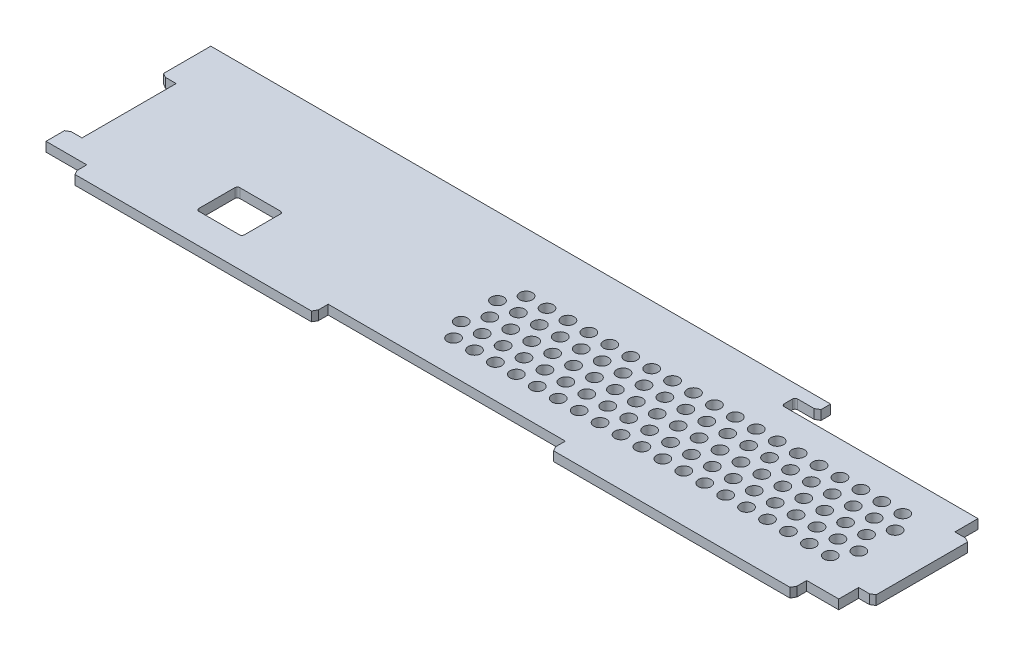
from build123d import *
from OCP.BRepFilletAPI import BRepFilletAPI_MakeChamfer

# Parameters (mm, degrees)
SKETCH1_W               = 245.11
SKETCH1_H               = 50
BOSS_EXTRUDE1_DEPTH     = 2.8575
SKETCH3_W               = 73.236666582
SKETCH3_H               = 4.318
BOSS_EXTRUDE2_DEPTH     = 2.8575
CUT_EXTRUDE1_REACH      = 128.045
SKETCH4_W               = 4.572
SKETCH4_H               = 28.575
SKETCH4_H_2             = 7.0105
SKETCH4_H_3             = 6.0325
CUT_EXTRUDE2_REACH      = 128.045
CUT_EXTRUDE3_REACH      = 128.045
SKETCH6_W               = 13.843
SKETCH6_H               = 12.446
SKETCH8_R               = 0.635
CUT_EXTRUDE4_DEPTH      = 0.127
FILL_PATTERN1_OUTLINE_R = 1.905
FILL_PATTERN1_DEPTH     = 2.8575
CHAMFER1_SIZE           = 0.762
CHAMFER1_SIZE2          = 1.319822715
CHAMFER2_SIZE           = 0.762
CHAMFER2_SIZE2          = 1.319822715
FILLET1_R               = 0.762


# Read off the part's stored shape, not the designer's step: Fill Pattern1
with BuildPart() as part:
    # Sketch1 → Boss-Extrude1 (new body)
    with BuildSketch(Plane(origin=(0, 0, 0), x_dir=(1, 0, 0), z_dir=(0, 1, 0))):
        Rectangle(SKETCH1_W, SKETCH1_H)
    extrude(amount=BOSS_EXTRUDE1_DEPTH)

    # Sketch3 → Boss-Extrude2 (add)
    with BuildSketch(Plane.XZ):
        with Locations((-73.554166709, 27.159)):
            Rectangle(SKETCH3_W, SKETCH3_H)
        with Locations((71.649166455, 27.159)):
            Rectangle(SKETCH3_W, SKETCH3_H)
    extrude(amount=-BOSS_EXTRUDE2_DEPTH)

    # Sketch4 → Cut-Extrude1 (cut, up to next)
    with BuildSketch(Plane(origin=(0, 2.8575, 0), x_dir=(1, 0, 0), z_dir=(0, 1, 0)), mode=Mode.PRIVATE) as cut_extrude1_sk1:
        with Locations((-120.269, -4.3625)):
            Rectangle(SKETCH4_W, SKETCH4_H)
    cut_extrude1_tool1 = extrude(cut_extrude1_sk1.sketch, amount=-CUT_EXTRUDE1_REACH, mode=Mode.PRIVATE) & part.part
    # Sketch4 → Cut-Extrude1 (cut, up to next)
    with BuildSketch(Plane(origin=(0, 2.8575, 0), x_dir=(1, 0, 0), z_dir=(0, 1, 0)), mode=Mode.PRIVATE) as cut_extrude1_sk2:
        with Locations((120.269, 13.74775)):
            Rectangle(SKETCH4_W, SKETCH4_H_2)
    cut_extrude1_tool2 = extrude(cut_extrude1_sk2.sketch, amount=-CUT_EXTRUDE1_REACH, mode=Mode.PRIVATE) & part.part
    # Sketch4 → Cut-Extrude1 (cut, up to next)
    with BuildSketch(Plane(origin=(0, 2.8575, 0), x_dir=(1, 0, 0), z_dir=(0, 1, 0)), mode=Mode.PRIVATE) as cut_extrude1_sk3:
        with Locations((120.269, -21.98375)):
            Rectangle(SKETCH4_W, SKETCH4_H_3)
    cut_extrude1_tool3 = extrude(cut_extrude1_sk3.sketch, amount=-CUT_EXTRUDE1_REACH, mode=Mode.PRIVATE) & part.part
    add(cut_extrude1_tool1.solids().sort_by_distance((-120.269, 2.8575, 4.3625))[0], mode=Mode.SUBTRACT)
    add(cut_extrude1_tool2.solids().sort_by_distance((120.269, 2.8575, -13.74775))[0], mode=Mode.SUBTRACT)
    add(cut_extrude1_tool3.solids().sort_by_distance((120.269, 2.8575, 21.98375))[0], mode=Mode.SUBTRACT)

    # Sketch5 → Cut-Extrude2 (cut, up to next)
    with BuildSketch(Plane(origin=(0, 2.8575, 0), x_dir=(1, 0, 0), z_dir=(0, 1, 0)), mode=Mode.PRIVATE) as cut_extrude2_sk1:
        Polygon((65.532, 25), (122.555, 25), (122.555, 17.253), (58.42, 17.253), (58.42, 21.317), (65.532, 21.317), align=None)
    cut_extrude2_tool1 = extrude(cut_extrude2_sk1.sketch, amount=-CUT_EXTRUDE2_REACH, mode=Mode.PRIVATE) & part.part
    add(cut_extrude2_tool1.solids().sort_by_distance((92.074241, 2.8575, -21.013414))[0], mode=Mode.SUBTRACT)

    # Sketch6 → Cut-Extrude3 (cut, up to next)
    with BuildSketch(Plane(origin=(0, 2.8575, 0), x_dir=(1, 0, 0), z_dir=(0, 1, 0)), mode=Mode.PRIVATE) as cut_extrude3_sk1:
        with Locations((-74.803, -14.0018)):
            Rectangle(SKETCH6_W, SKETCH6_H)
    cut_extrude3_tool1 = extrude(cut_extrude3_sk1.sketch, amount=-CUT_EXTRUDE3_REACH, mode=Mode.PRIVATE) & part.part
    add(cut_extrude3_tool1.solids().sort_by_distance((-74.803, 2.8575, 14.0018))[0], mode=Mode.SUBTRACT)

    # Sketch8 → Cut-Extrude4 (cut)
    with BuildSketch(Plane(origin=(0, 0, 0), x_dir=(1, 0, 0), z_dir=(0, 1, 0))):
        with Locations(Location((-115.443, -4.3625, 0), (0, 0, 270))):
            Circle(SKETCH8_R)
        with Locations(Location((-73.554166709, -26.778, 0), (0, 0, 270))):
            Circle(SKETCH8_R)
        with Locations(Location((71.649166455, -26.778, 0), (0, 0, 270))):
            Circle(SKETCH8_R)
        with Locations(Location((120.015, -3.3465, 0), (0, 0, 270))):
            Circle(SKETCH8_R)
        with Locations(Location((120.015, -5.3785, 0), (0, 0, 270))):
            Circle(SKETCH8_R)
    extrude(amount=CUT_EXTRUDE4_DEPTH, mode=Mode.SUBTRACT)

    # Fill Pattern1 outline → Fill Pattern1 (cut)
    with BuildSketch(Plane(origin=(0, 0, 0), x_dir=(1, 0, 0), z_dir=(0, 1, 0))):
        with Locations((-12.192, 1.625761314)):
            Circle(FILL_PATTERN1_OUTLINE_R)
        with Locations((70.358, 1.625761314)):
            Circle(FILL_PATTERN1_OUTLINE_R)
        with Locations((76.708, 1.625761314)):
            Circle(FILL_PATTERN1_OUTLINE_R)
        with Locations((83.058, 1.625761314)):
            Circle(FILL_PATTERN1_OUTLINE_R)
        with Locations((89.408, 1.625761314)):
            Circle(FILL_PATTERN1_OUTLINE_R)
        with Locations((3.683, 7.125022628)):
            Circle(FILL_PATTERN1_OUTLINE_R)
        with Locations((108.458, 1.625761314)):
            Circle(FILL_PATTERN1_OUTLINE_R)
        with Locations((102.108, 1.625761314)):
            Circle(FILL_PATTERN1_OUTLINE_R)
        with Locations((95.758, 1.625761314)):
            Circle(FILL_PATTERN1_OUTLINE_R)
        with Locations((64.008, 1.625761314)):
            Circle(FILL_PATTERN1_OUTLINE_R)
        with Locations((57.658, 1.625761314)):
            Circle(FILL_PATTERN1_OUTLINE_R)
        with Locations((51.308, 1.625761314)):
            Circle(FILL_PATTERN1_OUTLINE_R)
        with Locations((44.958, 1.625761314)):
            Circle(FILL_PATTERN1_OUTLINE_R)
        with Locations((38.608, 1.625761314)):
            Circle(FILL_PATTERN1_OUTLINE_R)
        with Locations((32.258, 1.625761314)):
            Circle(FILL_PATTERN1_OUTLINE_R)
        with Locations((25.908, 1.625761314)):
            Circle(FILL_PATTERN1_OUTLINE_R)
        with Locations((19.558, 1.625761314)):
            Circle(FILL_PATTERN1_OUTLINE_R)
        with Locations((10.033, 7.125022628)):
            Circle(FILL_PATTERN1_OUTLINE_R)
        with Locations((16.383, 7.125022628)):
            Circle(FILL_PATTERN1_OUTLINE_R)
        with Locations((22.733, 7.125022628)):
            Circle(FILL_PATTERN1_OUTLINE_R)
        with Locations((29.083, 7.125022628)):
            Circle(FILL_PATTERN1_OUTLINE_R)
        with Locations((35.433, 7.125022628)):
            Circle(FILL_PATTERN1_OUTLINE_R)
        with Locations((41.783, 7.125022628)):
            Circle(FILL_PATTERN1_OUTLINE_R)
        with Locations((48.133, 7.125022628)):
            Circle(FILL_PATTERN1_OUTLINE_R)
        with Locations((54.483, 7.125022628)):
            Circle(FILL_PATTERN1_OUTLINE_R)
        with Locations((60.833, 7.125022628)):
            Circle(FILL_PATTERN1_OUTLINE_R)
        with Locations((67.183, 7.125022628)):
            Circle(FILL_PATTERN1_OUTLINE_R)
        with Locations((73.533, 7.125022628)):
            Circle(FILL_PATTERN1_OUTLINE_R)
        with Locations((79.883, 7.125022628)):
            Circle(FILL_PATTERN1_OUTLINE_R)
        with Locations((86.233, 7.125022628)):
            Circle(FILL_PATTERN1_OUTLINE_R)
        with Locations((92.583, 7.125022628)):
            Circle(FILL_PATTERN1_OUTLINE_R)
        with Locations((98.933, 7.125022628)):
            Circle(FILL_PATTERN1_OUTLINE_R)
        with Locations((105.283, 7.125022628)):
            Circle(FILL_PATTERN1_OUTLINE_R)
        with Locations((86.233, -14.872022628)):
            Circle(FILL_PATTERN1_OUTLINE_R)
        with Locations((92.583, -14.872022628)):
            Circle(FILL_PATTERN1_OUTLINE_R)
        with Locations((98.933, -14.872022628)):
            Circle(FILL_PATTERN1_OUTLINE_R)
        with Locations((105.283, -14.872022628)):
            Circle(FILL_PATTERN1_OUTLINE_R)
        with Locations((-9.017, 7.125022628)):
            Circle(FILL_PATTERN1_OUTLINE_R)
        with Locations((-9.017, -3.8735)):
            Circle(FILL_PATTERN1_OUTLINE_R)
        with Locations((-5.842, -9.372761314)):
            Circle(FILL_PATTERN1_OUTLINE_R)
        with Locations((0.508, -9.372761314)):
            Circle(FILL_PATTERN1_OUTLINE_R)
        with Locations((6.858, -9.372761314)):
            Circle(FILL_PATTERN1_OUTLINE_R)
        with Locations((13.208, -9.372761314)):
            Circle(FILL_PATTERN1_OUTLINE_R)
        with Locations((19.558, -9.372761314)):
            Circle(FILL_PATTERN1_OUTLINE_R)
        with Locations((25.908, -9.372761314)):
            Circle(FILL_PATTERN1_OUTLINE_R)
        with Locations((32.258, -9.372761314)):
            Circle(FILL_PATTERN1_OUTLINE_R)
        with Locations((38.608, -9.372761314)):
            Circle(FILL_PATTERN1_OUTLINE_R)
        with Locations((44.958, -9.372761314)):
            Circle(FILL_PATTERN1_OUTLINE_R)
        with Locations((51.308, -9.372761314)):
            Circle(FILL_PATTERN1_OUTLINE_R)
        with Locations((79.883, -14.872022628)):
            Circle(FILL_PATTERN1_OUTLINE_R)
        with Locations((73.533, -14.872022628)):
            Circle(FILL_PATTERN1_OUTLINE_R)
        with Locations((67.183, -14.872022628)):
            Circle(FILL_PATTERN1_OUTLINE_R)
        with Locations((60.833, -14.872022628)):
            Circle(FILL_PATTERN1_OUTLINE_R)
        with Locations((54.483, -14.872022628)):
            Circle(FILL_PATTERN1_OUTLINE_R)
        with Locations((48.133, -14.872022628)):
            Circle(FILL_PATTERN1_OUTLINE_R)
        with Locations((41.783, -14.872022628)):
            Circle(FILL_PATTERN1_OUTLINE_R)
        with Locations((35.433, -14.872022628)):
            Circle(FILL_PATTERN1_OUTLINE_R)
        with Locations((29.083, -14.872022628)):
            Circle(FILL_PATTERN1_OUTLINE_R)
        with Locations((22.733, -14.872022628)):
            Circle(FILL_PATTERN1_OUTLINE_R)
        with Locations((16.383, -14.872022628)):
            Circle(FILL_PATTERN1_OUTLINE_R)
        with Locations((10.033, -14.872022628)):
            Circle(FILL_PATTERN1_OUTLINE_R)
        with Locations((3.683, -14.872022628)):
            Circle(FILL_PATTERN1_OUTLINE_R)
        with Locations((-2.667, -14.872022628)):
            Circle(FILL_PATTERN1_OUTLINE_R)
        with Locations((-9.017, -14.872022628)):
            Circle(FILL_PATTERN1_OUTLINE_R)
        with Locations((-12.192, -9.372761314)):
            Circle(FILL_PATTERN1_OUTLINE_R)
        with Locations((35.433, -3.8735)):
            Circle(FILL_PATTERN1_OUTLINE_R)
        with Locations((41.783, -3.8735)):
            Circle(FILL_PATTERN1_OUTLINE_R)
        with Locations((48.133, -3.8735)):
            Circle(FILL_PATTERN1_OUTLINE_R)
        with Locations((54.483, -3.8735)):
            Circle(FILL_PATTERN1_OUTLINE_R)
        with Locations((60.833, -3.8735)):
            Circle(FILL_PATTERN1_OUTLINE_R)
        with Locations((67.183, -3.8735)):
            Circle(FILL_PATTERN1_OUTLINE_R)
        with Locations((73.533, -3.8735)):
            Circle(FILL_PATTERN1_OUTLINE_R)
        with Locations((79.883, -3.8735)):
            Circle(FILL_PATTERN1_OUTLINE_R)
        with Locations((86.233, -3.8735)):
            Circle(FILL_PATTERN1_OUTLINE_R)
        with Locations((92.583, -3.8735)):
            Circle(FILL_PATTERN1_OUTLINE_R)
        with Locations((98.933, -3.8735)):
            Circle(FILL_PATTERN1_OUTLINE_R)
        with Locations((105.283, -3.8735)):
            Circle(FILL_PATTERN1_OUTLINE_R)
        with Locations((-2.667, 7.125022628)):
            Circle(FILL_PATTERN1_OUTLINE_R)
        with Locations((0.508, 1.625761314)):
            Circle(FILL_PATTERN1_OUTLINE_R)
        with Locations((6.858, 1.625761314)):
            Circle(FILL_PATTERN1_OUTLINE_R)
        with Locations((13.208, 1.625761314)):
            Circle(FILL_PATTERN1_OUTLINE_R)
        with Locations((57.658, -9.372761314)):
            Circle(FILL_PATTERN1_OUTLINE_R)
        with Locations((64.008, -9.372761314)):
            Circle(FILL_PATTERN1_OUTLINE_R)
        with Locations((70.358, -9.372761314)):
            Circle(FILL_PATTERN1_OUTLINE_R)
        with Locations((76.708, -9.372761314)):
            Circle(FILL_PATTERN1_OUTLINE_R)
        with Locations((83.058, -9.372761314)):
            Circle(FILL_PATTERN1_OUTLINE_R)
        with Locations((89.408, -9.372761314)):
            Circle(FILL_PATTERN1_OUTLINE_R)
        with Locations((95.758, -9.372761314)):
            Circle(FILL_PATTERN1_OUTLINE_R)
        with Locations((102.108, -9.372761314)):
            Circle(FILL_PATTERN1_OUTLINE_R)
        with Locations((29.083, -3.8735)):
            Circle(FILL_PATTERN1_OUTLINE_R)
        with Locations((22.733, -3.8735)):
            Circle(FILL_PATTERN1_OUTLINE_R)
        with Locations((16.383, -3.8735)):
            Circle(FILL_PATTERN1_OUTLINE_R)
        with Locations((10.033, -3.8735)):
            Circle(FILL_PATTERN1_OUTLINE_R)
        with Locations((108.458, -9.372761314)):
            Circle(FILL_PATTERN1_OUTLINE_R)
        with Locations((-5.842, 1.625761314)):
            Circle(FILL_PATTERN1_OUTLINE_R)
        with Locations((-2.667, -3.8735)):
            Circle(FILL_PATTERN1_OUTLINE_R)
        with Locations((3.683, -3.8735)):
            Circle(FILL_PATTERN1_OUTLINE_R)
    extrude(amount=FILL_PATTERN1_DEPTH, mode=Mode.SUBTRACT)

    # Chamfer1: one chamfer whose edges measure the first distance from different faces: ONE call of the kernel's chamfer builder (chamfer() names one face for all edges)
    chamfer1_edges_1 = [part.edges().sort_by_distance(p)[0] for p in [
        (-110.1725, 1.42875, 29.318),
    ]]
    chamfer1_side_1 = [part.faces().sort_by_distance(p)[0] for p in [
        (-73.554166709, 1.42875, 29.318),
    ]]
    chamfer1_edges_2 = [part.edges().sort_by_distance(p)[0] for p in [
        (35.030833164, 1.42875, 29.318),
    ]]
    chamfer1_side_2 = [part.faces().sort_by_distance(p)[0] for p in [
        (71.649166455, 1.42875, 29.318),
    ]]
    chamfer1_edges_3 = [part.edges().sort_by_distance(p)[0] for p in [
        (-122.555, 1.42875, -9.925),
    ]]
    chamfer1_side_3 = [part.faces().sort_by_distance(p)[0] for p in [
        (-122.555, 1.42875, -17.4625),
    ]]
    chamfer1_edges_4 = [part.edges().sort_by_distance(p)[0] for p in [
        (122.555, 1.42875, -10.2425),
    ]]
    chamfer1_side_4 = [part.faces().sort_by_distance(p)[0] for p in [
        (122.555, 1.42875, 4.3625),
    ]]
    chamfer1 = BRepFilletAPI_MakeChamfer(part.part.solid().wrapped)
    for e in chamfer1_edges_1:
        chamfer1.Add(CHAMFER1_SIZE, CHAMFER1_SIZE2, e.wrapped, chamfer1_side_1[0].wrapped)  # the first distance lies on this face
    for e in chamfer1_edges_2:
        chamfer1.Add(CHAMFER1_SIZE, CHAMFER1_SIZE2, e.wrapped, chamfer1_side_2[0].wrapped)  # the first distance lies on this face
    for e in chamfer1_edges_3:
        chamfer1.Add(CHAMFER1_SIZE, CHAMFER1_SIZE2, e.wrapped, chamfer1_side_3[0].wrapped)  # the first distance lies on this face
    for e in chamfer1_edges_4:
        chamfer1.Add(CHAMFER1_SIZE, CHAMFER1_SIZE2, e.wrapped, chamfer1_side_4[0].wrapped)  # the first distance lies on this face
    add(Compound.cast(chamfer1.Shape()), mode=Mode.REPLACE)

    # Chamfer2: one chamfer whose edges measure the first distance from different faces: ONE call of the kernel's chamfer builder (chamfer() names one face for all edges)
    chamfer2_edges_1 = [part.edges().sort_by_distance(p)[0] for p in [
        (-36.935833418, 1.42875, 29.318),
    ]]
    chamfer2_side_1 = [part.faces().sort_by_distance(p)[0] for p in [
        (-73.173166709, 1.42875, 29.318),
    ]]
    chamfer2_edges_2 = [part.edges().sort_by_distance(p)[0] for p in [
        (108.267499746, 1.42875, 29.318),
    ]]
    chamfer2_side_2 = [part.faces().sort_by_distance(p)[0] for p in [
        (72.030166455, 1.42875, 29.318),
    ]]
    chamfer2_edges_3 = [part.edges().sort_by_distance(p)[0] for p in [
        (-122.555, 1.42875, 18.65),
    ]]
    chamfer2_side_3 = [part.faces().sort_by_distance(p)[0] for p in [
        (-122.555, 1.42875, 21.825),
    ]]
    chamfer2_edges_4 = [part.edges().sort_by_distance(p)[0] for p in [
        (122.555, 1.42875, 18.9675),
    ]]
    chamfer2_side_4 = [part.faces().sort_by_distance(p)[0] for p in [
        (122.555, 1.42875, 4.7435),
    ]]
    chamfer2_edges_5 = [part.edges().sort_by_distance(p)[0] for p in [
        (65.532, 1.42875, -21.317),
    ]]
    chamfer2_side_5 = [part.faces().sort_by_distance(p)[0] for p in [
        (65.532, 1.42875, -23.1585),
    ]]
    chamfer2 = BRepFilletAPI_MakeChamfer(part.part.solid().wrapped)
    for e in chamfer2_edges_1:
        chamfer2.Add(CHAMFER2_SIZE, CHAMFER2_SIZE2, e.wrapped, chamfer2_side_1[0].wrapped)  # the first distance lies on this face
    for e in chamfer2_edges_2:
        chamfer2.Add(CHAMFER2_SIZE, CHAMFER2_SIZE2, e.wrapped, chamfer2_side_2[0].wrapped)  # the first distance lies on this face
    for e in chamfer2_edges_3:
        chamfer2.Add(CHAMFER2_SIZE, CHAMFER2_SIZE2, e.wrapped, chamfer2_side_3[0].wrapped)  # the first distance lies on this face
    for e in chamfer2_edges_4:
        chamfer2.Add(CHAMFER2_SIZE, CHAMFER2_SIZE2, e.wrapped, chamfer2_side_4[0].wrapped)  # the first distance lies on this face
    for e in chamfer2_edges_5:
        chamfer2.Add(CHAMFER2_SIZE, CHAMFER2_SIZE2, e.wrapped, chamfer2_side_5[0].wrapped)  # the first distance lies on this face
    add(Compound.cast(chamfer2.Shape()), mode=Mode.REPLACE)

    # Fillet1
    fillet1_edges = [part.edges().sort_by_distance(p)[0] for p in [
        (-81.7245, 1.42875, 20.2248),
        (-81.7245, 1.42875, 7.7788),
        (-67.8815, 1.42875, 7.7788),
        (-67.8815, 1.42875, 20.2248),
        (58.42, 1.42875, -17.253),
        (58.42, 1.42875, -21.317),
    ]]
    fillet(fillet1_edges, radius=FILLET1_R)


solid = part.part
